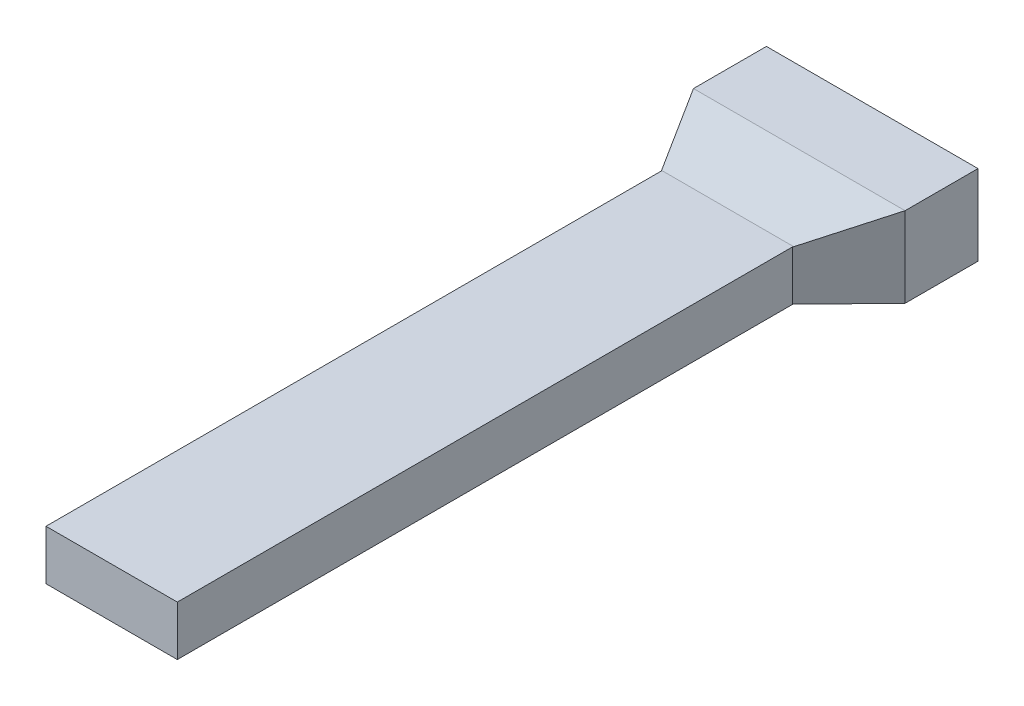
from build123d import *

# Parameters (mm, degrees)
CROQUIS1_W              = 29
CROQUIS1_H              = 11
SALIENTE_EXTRUIR1_DEPTH = 10
CROQUIS2_W              = 18
CROQUIS2_H              = 6.827586207
SALIENTE_EXTRUIR2_DEPTH = 94.25
CROQUIS3_W              = 29
CROQUIS3_H              = 11
SALIENTE_EXTRUIR5_DEPTH = 10
CHAFL_N1_SIZE           = 10
CHAFL_N1_SIZE_2         = 2.125565617
CHAFL_N2_SIZE           = 10
CHAFL_N2_SIZE_2         = 2.125565617
CHAFL_N6_SIZE2          = 5.543090515
CHAFL_N6_SIZE           = 10
CHAFL_N7_SIZE           = 5.543090515
CHAFL_N7_SIZE_2         = 10


# Some blends are built 0.0001 mm under size
with BuildPart() as part:
    # Croquis1 → Saliente-Extruir1 (new body)
    with BuildSketch(Plane.XY):
        with Locations((-7.808491758, -6.83172232)):
            Rectangle(CROQUIS1_W, CROQUIS1_H)
    extrude(amount=SALIENTE_EXTRUIR1_DEPTH)

    # Croquis2 → Saliente-Extruir2 (add)
    with BuildSketch(Plane.XY.offset(10)):
        with Locations((-7.808491758, -6.83172232)):
            Rectangle(CROQUIS2_W, CROQUIS2_H)
    extrude(amount=SALIENTE_EXTRUIR2_DEPTH)


with BuildPart() as body_2:
    # Croquis3 → Saliente-Extruir5 (new body)
    with BuildSketch(Plane.XY.offset(10)):
        with Locations((-7.808491758, -6.83172232)):
            Rectangle(CROQUIS3_W, CROQUIS3_H)
    extrude(amount=SALIENTE_EXTRUIR5_DEPTH)

    # Chaflán1
    # the kernel refuses this chamfer: 10, 2.125565617 mm, written as the material it takes off along each edge
    with BuildSketch(Plane(origin=(32.670487822, -12.33172232, 20), x_dir=(0, -0.008003073799517237, -0.999967974892076), z_dir=(-1, 0, 0))) as chafl_n1_piece_1:
        Polygon((CHAFL_N1_SIZE * 0.999967974892, -CHAFL_N1_SIZE * 0.00800307379952), (-CHAFL_N1_SIZE_2 * 0.00800307379839, -CHAFL_N1_SIZE_2 * 0.999967974751), (0, 0), align=None)
    extrude(amount=80.957959161, mode=Mode.SUBTRACT)

    # Chaflán2
    # the kernel refuses this chamfer: 10, 2.125565617 mm, written as the material it takes off along each edge
    with BuildSketch(Plane(origin=(-48.287471339, -1.33172232, 20), x_dir=(0, 0.008003073799517172, -0.999967974892076), z_dir=(1, 0, 0))) as chafl_n2_piece_1:
        Polygon((CHAFL_N2_SIZE * 0.999967974892, -CHAFL_N2_SIZE * 0.00800307379952), (-CHAFL_N2_SIZE_2 * 0.00800307379839, -CHAFL_N2_SIZE_2 * 0.999967974751), (0, 0), align=None)
    extrude(amount=80.957959161, mode=Mode.SUBTRACT)

    # Chaflán6
    chafl_n6_edges = [body_2.edges().sort_by_distance(p)[0] for p in [
        (6.691508242, -6.83172232, 20),
    ]]
    chafl_n6_side = [body_2.faces().sort_by_distance(p)[0] for p in [
        (6.691508242, -6.83172232, 19.88913819),
    ]]
    chamfer(chafl_n6_edges, length=CHAFL_N6_SIZE - 0.0001, length2=CHAFL_N6_SIZE2 - 0.0001, reference=chafl_n6_side[0])  # a hair under: the kernel refuses the full size

    # Chaflán7
    # the kernel refuses this chamfer: 10, 5.543090515 mm, written as the material it takes off along each edge
    with BuildSketch(Plane(origin=(-22.308491758, -36.085317921, 20), x_dir=(0.9981458389905736, 0, 0.06086775916528887), z_dir=(0, 1, 0))) as chafl_n7_piece_1:
        Polygon((CHAFL_N7_SIZE * 0.998145838906, CHAFL_N7_SIZE * 0.0608677591601), (-CHAFL_N7_SIZE_2 * 0.0608677591653, CHAFL_N7_SIZE_2 * 0.998145838991), (0, 0), align=None)
    extrude(amount=58.507191203, mode=Mode.SUBTRACT)


solid = Compound([part.part, body_2.part])
